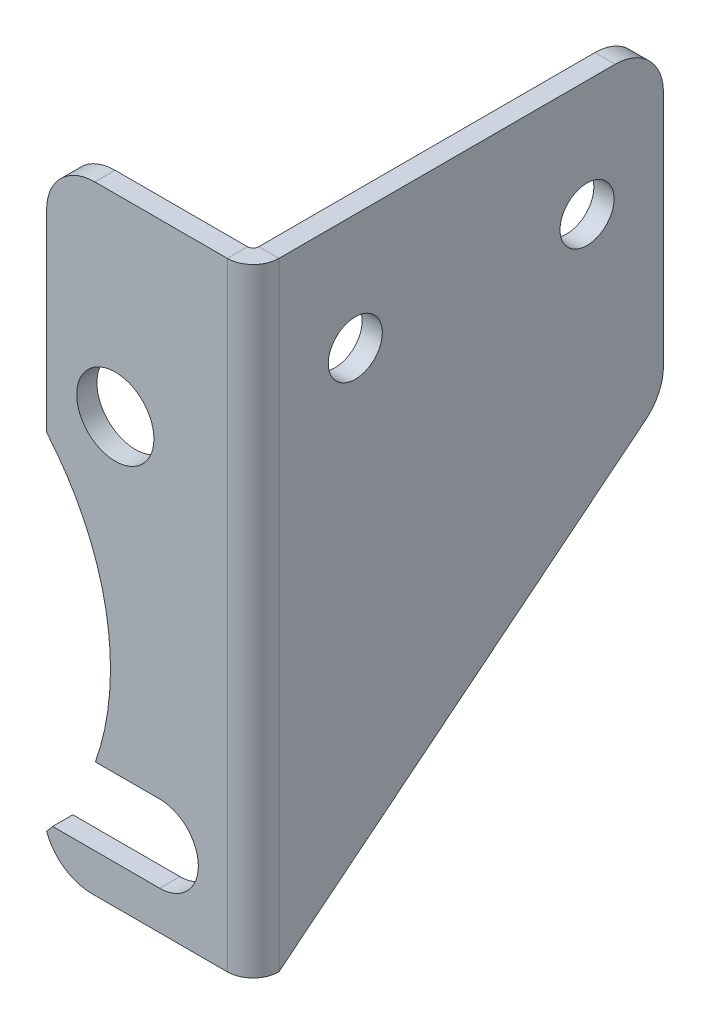
from build123d import *

# Parameters (mm, degrees)
SKETCH2_R          = 5.08
BASE_FLANGE2_DEPTH = 2.65684
EDGE_FLANGE2_DEPTH = 81.28
SKETCH18_R         = 3.556
CUT_EXTRUDE1_DEPTH = 2.65684
FILLET1_R          = 6.35


# Sheet-metal steps are written as plain solids
with BuildPart() as part:
    # Sketch2 → Base-Flange2 (new body)
    with BuildSketch(Plane.XY):
        with BuildLine():
            Line((-11.8872, -36.520431679), (-11.8872, -40.64))
            Line((-11.8872, -40.64), (11.8872, -40.64))
            Line((11.8872, -40.64), (11.8872, 40.64))
            Line((11.8872, 40.64), (-11.8872, 40.64))
            Line((-11.8872, 40.64), (-11.8872, 8.936031679))
            ThreePointArc((-11.8872, 8.936031679), (-4.075086446, -7.37142183), (-5.465240134, -25.4))
            Line((-5.465240134, -25.4), (2.9972, -25.4))
            ThreePointArc((2.9972, -25.4), (8.0772, -30.48), (2.9972, -35.56))
            Line((2.9972, -35.56), (-11.093291287, -35.56))
            ThreePointArc((-11.093291287, -35.56), (-11.485961922, -36.043756834), (-11.8872, -36.520431679))
        make_face()
        with Locations((-2.8448, 15.24)):
            Circle(SKETCH2_R, mode=Mode.SUBTRACT)
    extrude(amount=-BASE_FLANGE2_DEPTH)

    # Edge-Flange2 section (across the edge) → Edge-Flange2 (add)
    with BuildSketch(Plane(origin=(12.6238, 40.64, -2.65684), x_dir=(-1, 0, 0), z_dir=(0, -1, 0))):
        with BuildLine():
            Line((-2.65684, 0.7366), (-2.65684, 51.31816))
            Line((-2.65684, 51.31816), (0, 51.31816))
            Line((0, 51.31816), (0, 0.7366))
            ThreePointArc((0, 0.7366), (0.215745145, 0.215745145), (0.7366, 0))
            Line((0.7366, 0), (0.7366, -2.65684))
            ThreePointArc((0.7366, -2.65684), (-1.662924436, -1.662924436), (-2.65684, 0.7366))
        make_face()
    extrude(amount=EDGE_FLANGE2_DEPTH)

    # Sketch18 → Cut-Extrude1 (cut)
    with BuildSketch(Plane(origin=(15.28064, 0, 0), x_dir=(0, 0, -1), z_dir=(1, 0, 0))):
        with Locations((13.44422, 25.4)):
            Circle(SKETCH18_R)
        with Locations((43.92422, 25.4)):
            Circle(SKETCH18_R)
        Polygon((53.975, 0), (53.975, -40.64), (3.39344, -40.64), align=None)
    extrude(amount=-CUT_EXTRUDE1_DEPTH, mode=Mode.SUBTRACT)

    # Fillet1
    # the kernel refuses this fillet: 6.35 mm, written as the material it takes off along each edge
    with BuildSketch(Plane(origin=(-11.8872, 40.64, 15.875), x_dir=(0, -1, 0), z_dir=(0, 0, -1)), Plane(origin=(31.15564, 40.64, -53.975), x_dir=(0, 0, 1), z_dir=(-1, 0, 0))) as fillet1_piece_1:
        with BuildLine():
            CenterArc((FILLET1_R, -FILLET1_R), FILLET1_R, 90, 90)
            Line((0, -FILLET1_R), (-FILLET1_R * 0.02, -FILLET1_R))
            Line((-FILLET1_R * 0.02, -FILLET1_R), (-FILLET1_R * 0.02, FILLET1_R * 0.02))
            Line((-FILLET1_R * 0.02, FILLET1_R * 0.02), (FILLET1_R, FILLET1_R * 0.02))
            Line((FILLET1_R, FILLET1_R * 0.02), (FILLET1_R, 0))
        make_face()
    extrude(amount=34.40684, mode=Mode.SUBTRACT)
    with BuildSketch(Plane(origin=(-11.8872, -40.64, 14.863477581), x_dir=(0, 1, 0), z_dir=(0, 0, -1))) as fillet1_piece_2:
        with BuildLine():
            CenterArc((6.35, 5.945391032), FILLET1_R, 180, 69.436266332)
            Line((0, 5.945391032), (-0.127, 5.945391032))
            Line((-0.127, 5.945391032), (-0.127, 0))
            Line((-0.127, 0), (0, -0.127))
            ThreePointArc((0, -0.127), (2.059784161, -0.127), (4.074959688, -0.118907821))
            Line((4.074959688, -0.118907821), (4.119568321, 0))
        make_face()
    extrude(amount=32.383795161, mode=Mode.SUBTRACT)
    with BuildSketch(Plane(origin=(22.890020574, 0, -53.975), x_dir=(-2.7142023433715092e-15, -0.6263358882152561, 0.7795533048699147), z_dir=(-1, 0, 0))) as fillet1_piece_3:
        with BuildLine():
            CenterArc((FILLET1_R * 0.479331059788, FILLET1_R), FILLET1_R, 218.780305406, 51.219694594)
            Line((-FILLET1_R * 0.300222245082, FILLET1_R * 0.373664111785), (-FILLET1_R * 0.315813311179, FILLET1_R * 0.36113739402))
            Line((-FILLET1_R * 0.315813311179, FILLET1_R * 0.36113739402), (-FILLET1_R * 0.00958662119577, -FILLET1_R * 0.02))
            Line((-FILLET1_R * 0.00958662119577, -FILLET1_R * 0.02), (FILLET1_R * 0.479331059788, -FILLET1_R * 0.02))
            Line((FILLET1_R * 0.479331059788, -FILLET1_R * 0.02), (FILLET1_R * 0.479331059788, 0))
        make_face()
    extrude(amount=17.875601148, mode=Mode.SUBTRACT)


solid = part.part
